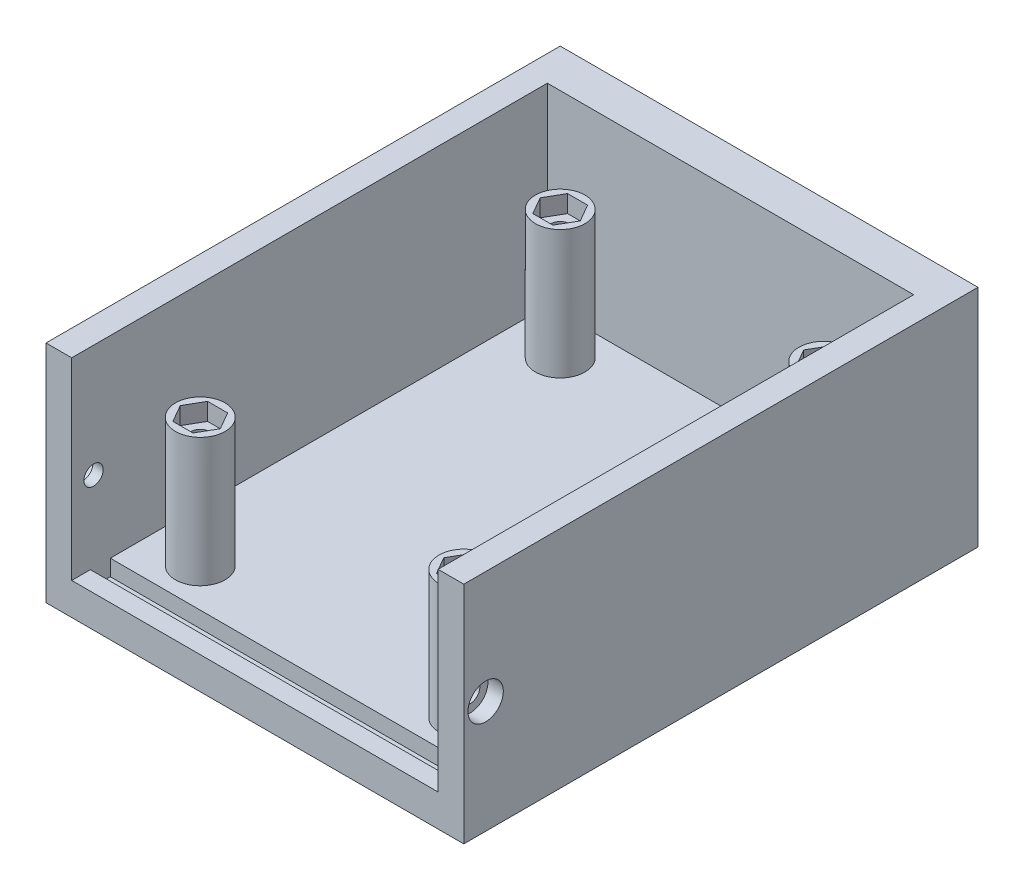
from build123d import *

# Parameters (mm, degrees)
SKETCH1_W                                = 65
SKETCH1_H                                = 80
BOSS_EXTRUDE1_DEPTH                      = 5
SKETCH2_W                                = 65
SKETCH2_H                                = 80
SKETCH2_W_2                              = 57
SKETCH2_H_2                              = 68
BOSS_EXTRUDE2_DEPTH                      = 30
SKETCH3_R                                = 3.85
BOSS_EXTRUDE3_DEPTH                      = 20
F_3_0MM_DOWEL_HOLE1_D                    = 3
F_3_0MM_DOWEL_HOLE1_DEPTH                = 8.5
F_3_0MM_DOWEL_HOLE1_CSINK_D              = 3.05
F_3_0MM_DOWEL_HOLE1_CSINK_ANGLE          = 90
F_3_0MM_DOWEL_HOLE1_TIP                  = 0.901290929
CUT_EXTRUDE1_DEPTH                       = 2.7
MIRROR1_AT_THE_SECOND_PLANE_COPY_1_DEPTH = 2.7
SKETCH13_R                               = 2.75
CUT_EXTRUDE4_DEPTH                       = 2.4
SKETCH14_R                               = 1.5
CUT_EXTRUDE5_DEPTH                       = 4
SKETCH11_W                               = 57
SKETCH11_H                               = 6
CUT_EXTRUDE2_DEPTH                       = 30
SKETCH15_W                               = 57
SKETCH15_H                               = 3.1
CUT_EXTRUDE6_DEPTH                       = 2.5


with BuildPart() as part:
    # Sketch1 → Boss-Extrude1 (new body)
    with BuildSketch(Plane(origin=(0, 0, 0), x_dir=(1, 0, 0), z_dir=(0, 1, 0))):
        Rectangle(SKETCH1_W, SKETCH1_H)
    extrude(amount=BOSS_EXTRUDE1_DEPTH)

    # Sketch2 → Boss-Extrude2 (add)
    with BuildSketch(Plane(origin=(0, 5, 0), x_dir=(1, 0, 0), z_dir=(0, 1, 0))):
        Rectangle(SKETCH2_W, SKETCH2_H)
        Rectangle(SKETCH2_W_2, SKETCH2_H_2, mode=Mode.SUBTRACT)
    extrude(amount=BOSS_EXTRUDE2_DEPTH)

    # Sketch3 → Boss-Extrude3 (add)
    with BuildSketch(Plane(origin=(0, 5, 0), x_dir=(1, 0, 0), z_dir=(0, 1, 0))):
        with Locations((-20.5, -28)):
            Circle(SKETCH3_R)
        with Locations((20.5, -28)):
            Circle(SKETCH3_R)
        with Locations((20.5, 28)):
            Circle(SKETCH3_R)
        with Locations((-20.5, 28)):
            Circle(SKETCH3_R)
    extrude(amount=BOSS_EXTRUDE3_DEPTH)

    # Ø3.0mm Dowel Hole1
    with Locations(Plane(origin=(0, 25, 0), x_dir=(1, 0, 0), z_dir=(0, 1, 0))):
        with Locations((-20.5, 28), (20.5, 28), (20.5, -28), (-20.5, -28)):
            CounterSinkHole(F_3_0MM_DOWEL_HOLE1_D / 2, F_3_0MM_DOWEL_HOLE1_CSINK_D / 2, depth=F_3_0MM_DOWEL_HOLE1_DEPTH, counter_sink_angle=F_3_0MM_DOWEL_HOLE1_CSINK_ANGLE)
            with Locations((0, 0, -(F_3_0MM_DOWEL_HOLE1_DEPTH + F_3_0MM_DOWEL_HOLE1_TIP / 2))):  # 118° drill point
                Cone(0, F_3_0MM_DOWEL_HOLE1_D / 2, F_3_0MM_DOWEL_HOLE1_TIP, mode=Mode.SUBTRACT)

    # Sketch8 → Cut-Extrude1 (cut)
    with BuildSketch(Plane(origin=(0, 25, 0), x_dir=(1, 0, 0), z_dir=(0, 1, 0))):
        Polygon((-17.382308546, 28), (-18.941154273, 30.7), (-22.058845727, 30.7), (-23.617691454, 28), (-22.058845727, 25.3), (-18.941154273, 25.3), align=None)
    cut_extrude1 = extrude(amount=-CUT_EXTRUDE1_DEPTH, mode=Mode.SUBTRACT)

    # Mirror1: Cut-Extrude1 across plane
    add(cut_extrude1.mirror(Plane.XY), mode=Mode.SUBTRACT)

    # Mirror1 at the second plane: Cut-Extrude1 across plane
    add(cut_extrude1.mirror(Plane(origin=(0, 0, 0), x_dir=(0, 0, 1), z_dir=(1, 0, 0))), mode=Mode.SUBTRACT)

    # Mirror1 at the second plane copy 1 sketc → Mirror1 at the second plane copy 1 (cut)
    with BuildSketch(Plane(origin=(0, 25, 0), x_dir=(-1, 0, 0), z_dir=(0, 1, 0))):
        Polygon((-17.382308546, 28), (-18.941154273, 30.7), (-22.058845727, 30.7), (-23.617691454, 28), (-22.058845727, 25.3), (-18.941154273, 25.3), align=None)
    extrude(amount=-MIRROR1_AT_THE_SECOND_PLANE_COPY_1_DEPTH, mode=Mode.SUBTRACT)

    # Sketch13 → Cut-Extrude4 (cut)
    with BuildSketch(Plane(origin=(32.5, 0, 0), x_dir=(0, 0, -1), z_dir=(1, 0, 0))):
        with Locations((-36.6, 17.5)):
            Circle(SKETCH13_R)
    cut_extrude4 = extrude(amount=-CUT_EXTRUDE4_DEPTH, mode=Mode.SUBTRACT)

    # Sketch14 → Cut-Extrude5 (cut)
    with BuildSketch(Plane(origin=(32.5, 0, 0), x_dir=(0, 0, -1), z_dir=(1, 0, 0))):
        with Locations((-36.6, 17.5)):
            Circle(SKETCH14_R)
    cut_extrude5 = extrude(amount=-CUT_EXTRUDE5_DEPTH, mode=Mode.SUBTRACT)

    # Mirror2: Cut-Extrude4, Cut-Extrude5 across plane
    add(cut_extrude4.mirror(Plane(origin=(0, 0, 0), x_dir=(0, 0, 1), z_dir=(1, 0, 0))), mode=Mode.SUBTRACT)
    add(cut_extrude5.mirror(Plane(origin=(0, 0, 0), x_dir=(0, 0, 1), z_dir=(1, 0, 0))), mode=Mode.SUBTRACT)

    # Sketch11 → Cut-Extrude2 (cut)
    with BuildSketch(Plane(origin=(0, 35, 0), x_dir=(1, 0, 0), z_dir=(0, 1, 0))):
        with Locations((0, -37)):
            Rectangle(SKETCH11_W, SKETCH11_H)
    extrude(amount=-CUT_EXTRUDE2_DEPTH, mode=Mode.SUBTRACT)

    # Sketch15 → Cut-Extrude6 (cut)
    with BuildSketch(Plane(origin=(0, 5, 0), x_dir=(1, 0, 0), z_dir=(0, 1, 0))):
        with Locations((0, -35.55)):
            Rectangle(SKETCH15_W, SKETCH15_H)
    extrude(amount=-CUT_EXTRUDE6_DEPTH, mode=Mode.SUBTRACT)


solid = part.part
